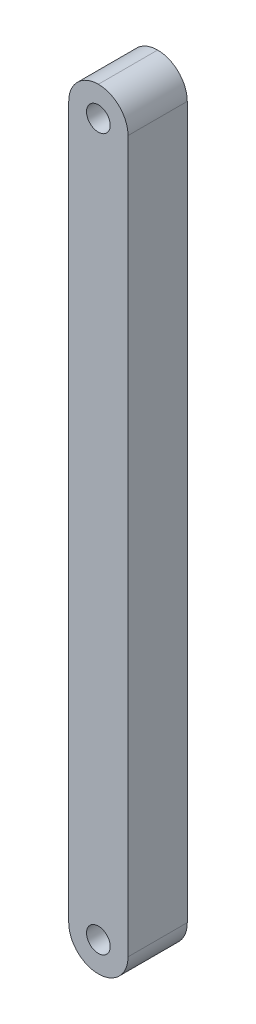
from build123d import *

# Parameters (mm, degrees)
ESQUISSE1_W             = 10
ESQUISSE1_H             = 130
BOSS_EXTRU_1_DEPTH      = 10
ESQUISSE2_R             = 2
ENL_V_MAT_EXTRU_1_DEPTH = 10
CONG_1_R                = 5


with BuildPart() as part:
    # Esquisse1 → Boss.-Extru.1 (new body)
    with BuildSketch(Plane.XY):
        with Locations((5, 65)):
            Rectangle(ESQUISSE1_W, ESQUISSE1_H)
    extrude(amount=BOSS_EXTRU_1_DEPTH)

    # Esquisse2 → Enlèv. mat.-Extru.1 (cut)
    with BuildSketch(Plane.XY.offset(10)):
        with Locations((5, 125)):
            Circle(ESQUISSE2_R)
        with Locations((5, 5)):
            Circle(ESQUISSE2_R)
    extrude(amount=-ENL_V_MAT_EXTRU_1_DEPTH, mode=Mode.SUBTRACT)

    # Congé1
    cong_1_edges = [part.edges().sort_by_distance(p)[0] for p in [
        (10, 130, 5),
        (0, 130, 5),
        (10, 0, 5),
        (0, 0, 5),
    ]]
    fillet(cong_1_edges, radius=CONG_1_R - 0.0001)  # a hair under: the kernel refuses the full size


solid = part.part
